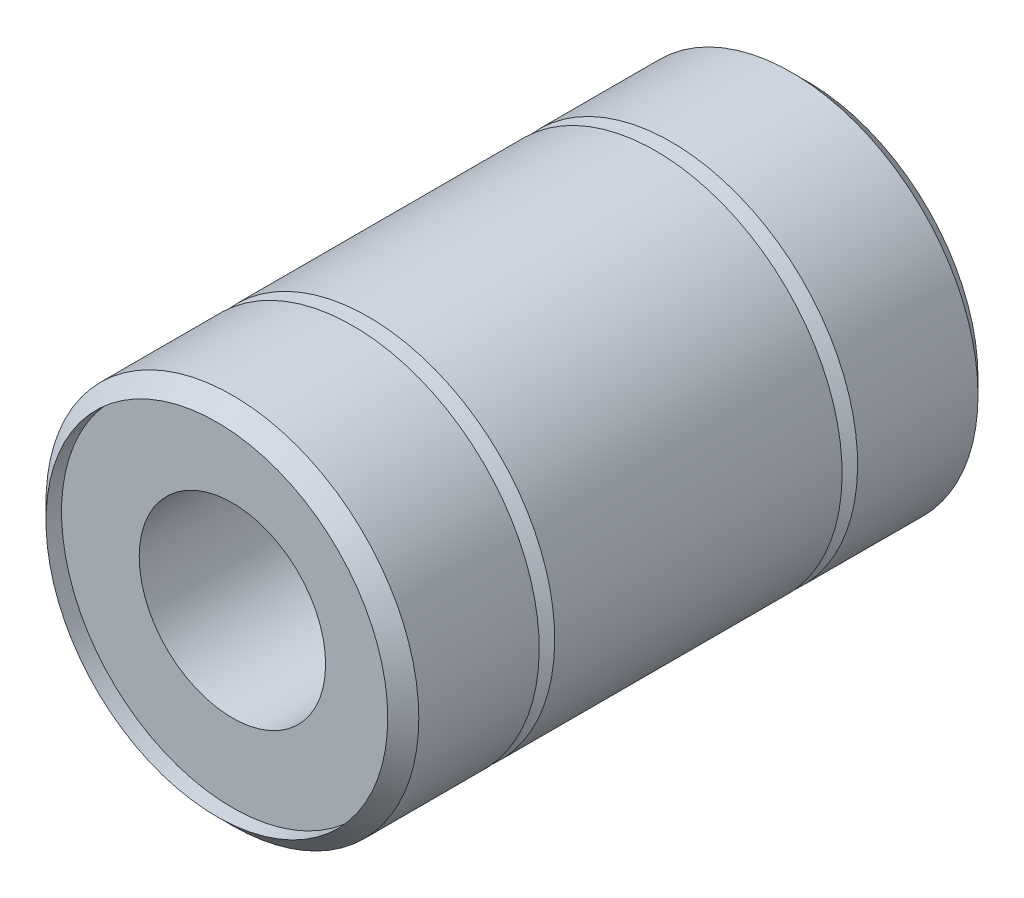
from build123d import *

# Parameters (mm, degrees)
SKETCH_1_R          = 6
SKETCH_1_R_2        = 3
EXTRUDE_1_DEPTH     = 9.5
CHAMFER_1_SIZE      = 0.5
SKETCH_2_R          = 5.5
CUT_EXTRUDE_1_DEPTH = 0.5


with BuildPart() as part:
    # 스케치1 → 보스-돌출1 (new, symmetric)
    with BuildSketch(Plane.XY):
        Circle(SKETCH_1_R)
        Circle(SKETCH_1_R_2, mode=Mode.SUBTRACT)
    extrude(amount=EXTRUDE_1_DEPTH, both=True)

    # 모따기1
    chamfer_1_edges = [part.edges().sort_by_distance(p)[0] for p in [
        (-6, 0, -9.5),
        (-6, 0, 9.5),
    ]]
    chamfer(chamfer_1_edges, length=CHAMFER_1_SIZE)

    # 스케치2 → 컷-돌출1 (cut)
    with BuildSketch(Plane.XY.offset(9.5)):
        Circle(SKETCH_2_R)
    cut_extrude_1 = extrude(amount=-CUT_EXTRUDE_1_DEPTH, mode=Mode.SUBTRACT)

    # 대칭 복사1: 컷-돌출1 across plane
    add(cut_extrude_1.mirror(Plane.XY), mode=Mode.SUBTRACT)

    # 스케치3 → 컷-회전1 (revolve, cut)
    with BuildSketch(Plane(origin=(0, 0, 0), x_dir=(0, 0, -1), z_dir=(1, 0, 0))):
        Polygon((-4.625, 6), (-5.125, 6), (-4.875, 5.566987298), align=None)
        Polygon((4.625, 6), (5.125, 6), (4.875, 5.566987298), align=None)
    revolve(axis=Axis((0, 0, 9), (0, 0, -1)), mode=Mode.SUBTRACT)


solid = part.part
